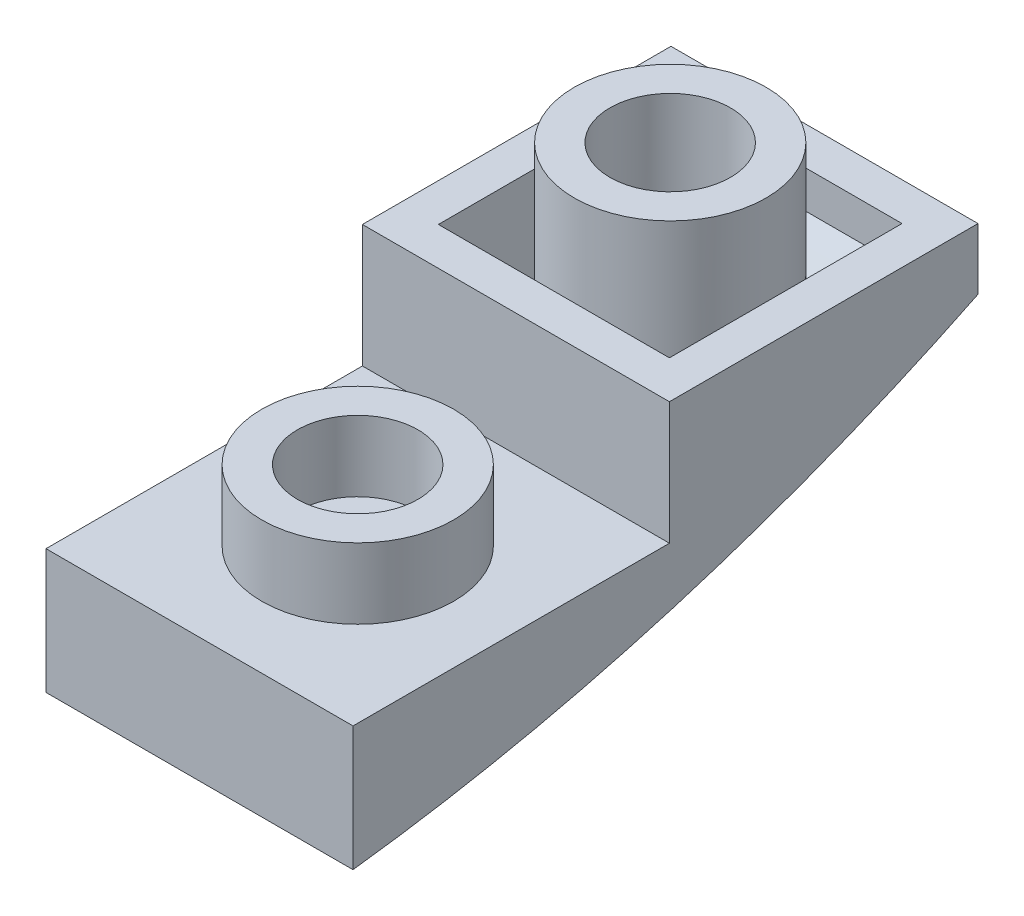
from build123d import *

# Parameters (mm, degrees)
BOSS_EXTRUDE1_DEPTH      = 7.84
SHELL1_START             = -6.87
SHELL1_DEPTH             = 5.9
BOSS_EXTRUDE2_REACH      = 26.75
BOSS_EXTRUDE2_END_RADIUS = 49.03
SKETCH2_R                = 2.45
SKETCH2_R_2              = 1.54
SKETCH3_R                = 2.45
SKETCH3_R_2              = 1.54
BOSS_EXTRUDE3_DEPTH      = 1.8


# Read off the part's stored shape, not the designer's step: Shell1
with BuildPart() as part:
    # Sketch1 → Boss-Extrude1 (new body)
    with BuildSketch(Plane(origin=(0, 0, 0), x_dir=(0, 0, -1), z_dir=(1, 0, 0))):
        with BuildLine():
            Line((22.029982318, -44.885185519), (22.029982318, -43.320185519))
            Line((22.029982318, -43.320185519), (14.149982318, -43.320185519))
            Line((14.149982318, -43.320185519), (14.149982318, -46.450185519))
            Line((14.149982318, -46.450185519), (6.069982318, -46.450185519))
            Line((6.069982318, -46.450185519), (6.069982318, -49.630185519))
            ThreePointArc((6.069982318, -49.630185519), (14.24888625, -47.926706966), (22.029982318, -44.885185519))
        make_face()
    extrude(amount=-BOSS_EXTRUDE1_DEPTH)

    # Shell1 outline → Shell1 (cut)
    with BuildSketch(Plane.YZ.offset(SHELL1_START)):
        with BuildLine():
            Line((-43.320185519, -15.119982318), (-46.640401314, -15.119982318))
            ThreePointArc((-46.640401314, -15.119982318), (-45.555422953, -18.128550399), (-44.276608325, -21.059982318))
            Line((-44.276608325, -21.059982318), (-43.320185519, -21.059982318))
            Line((-43.320185519, -21.059982318), (-43.320185519, -15.119982318))
        make_face()
        with BuildLine():
            Line((-47.420185519, -7.039982318), (-48.521949146, -7.039982318))
            ThreePointArc((-48.521949146, -7.039982318), (-48.047571358, -9.765847969), (-47.420185519, -12.460614163))
            Line((-47.420185519, -12.460614163), (-47.420185519, -7.039982318))
        make_face()
    extrude(amount=SHELL1_DEPTH, mode=Mode.SUBTRACT)

    # Boss-Extrude2: up to this cylinder (the profile starts inside it)
    boss_extrude2_end = Plane(origin=(-3.92, 0, 0), z_dir=(1, 0, 0)) * Cylinder(BOSS_EXTRUDE2_END_RADIUS, 152.56, mode=Mode.PRIVATE)
    # Sketch2 → Boss-Extrude2 (add, up to the surface)
    with BuildSketch(Plane(origin=(0, -41.520185519, 0), x_dir=(1, 0, 0), z_dir=(0, 1, 0)), mode=Mode.PRIVATE) as boss_extrude2_sk1:
        with Locations(Location((-3.92, 18.089982318, 0), (0, 0, 270))):
            Circle(SKETCH2_R)
        with Locations(Location((-3.92, 18.089982318, 0), (0, 0, 270))):
            Circle(SKETCH2_R_2, mode=Mode.SUBTRACT)
    boss_extrude2_tool1 = extrude(boss_extrude2_sk1.sketch, amount=-BOSS_EXTRUDE2_REACH, mode=Mode.PRIVATE) & boss_extrude2_end
    add(boss_extrude2_tool1.solids().sort_by_distance((-3.92, -41.520186, -20.470686))[0])

    # Sketch3 → Boss-Extrude3 (add)
    with BuildSketch(Plane(origin=(0, -46.450185519, 0), x_dir=(1, 0, 0), z_dir=(0, 1, 0))):
        with Locations(Location((-3.92, 10.109982318, 0), (0, 0, 270))):
            Circle(SKETCH3_R)
        with Locations(Location((-3.92, 10.109982318, 0), (0, 0, 270))):
            Circle(SKETCH3_R_2, mode=Mode.SUBTRACT)
    extrude(amount=BOSS_EXTRUDE3_DEPTH)


solid = part.part
